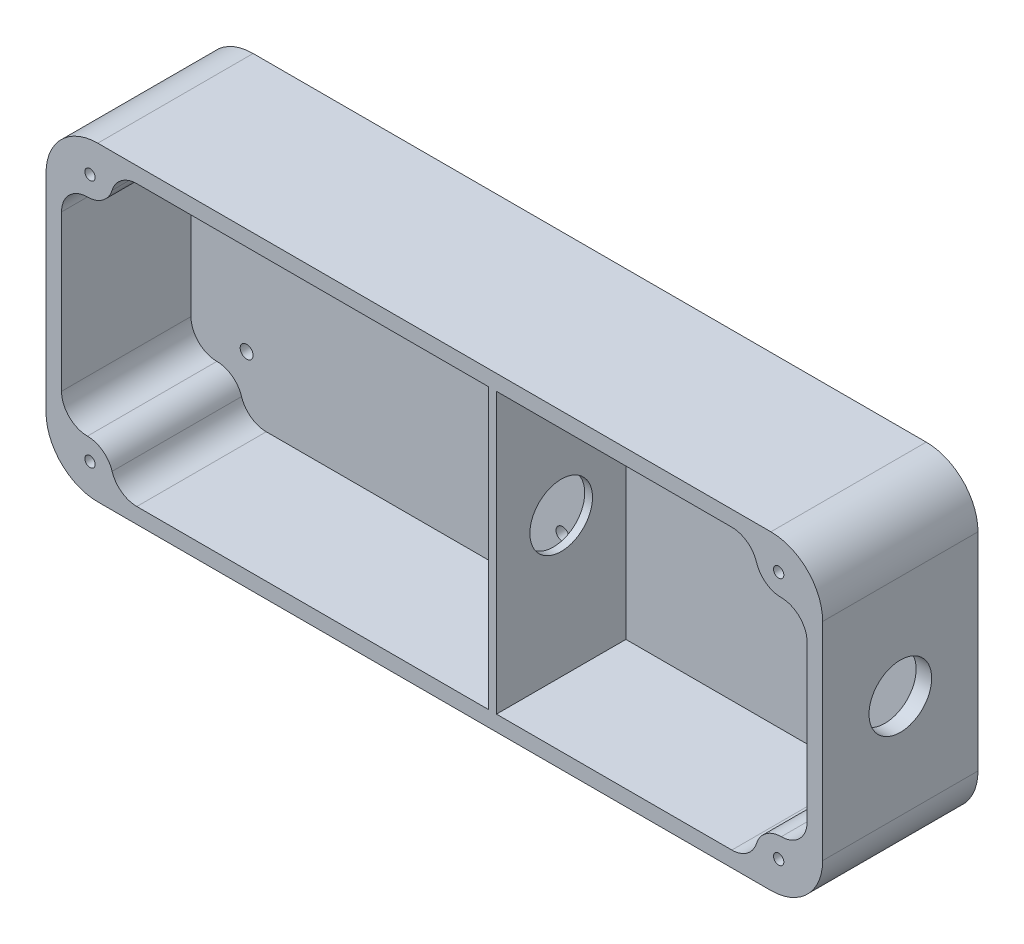
from build123d import *

# Parameters (mm, degrees)
SKETCH_1_W           = 300
SKETCH_1_H           = 120
EXTRUDE_2_DEPTH      = 60
SKETCH_2_W           = 120
SKETCH_2_H           = 80
SKETCH_2_W_2         = 165
CUT_EXTRUDE_1_DEPTH  = 50
FILLET_5_R           = 20
SKETCH_2_5_R         = 2
CUT_EXTRUDE_5_DEPTH  = 40
CUT_EXTRUDE_4_REACH  = 313.769
SKETCH_10_R          = 12.1
SKETCH_13_R          = 5
CUT_EXTRUDE_7_DEPTH  = 20
CUT_EXTRUDE_8_REACH  = 195.587
SKETCH_16_R          = 2.5
CUT_EXTRUDE_9_DEPTH  = 6
SKETCH_2_7_W         = 100
SKETCH_2_7_H         = 14
SKETCH_2_7_W_2       = 145
CUT_EXTRUDE_10_DEPTH = 50
FILLET_6_R           = 10
FILLET_7_R           = 10
FILLET_8_R           = 10
FILLET_9_R           = 10
FILLET_10_R          = 10
FILLET_11_R          = 10
FILLET_12_R          = 10
FILLET_14_R          = 10
FILLET_15_R          = 10
FILLET_16_R          = 10


with BuildPart() as part:
    # Эскиз1 → Бобышка-Вытянуть2 (new body)
    with BuildSketch(Plane.XY):
        Rectangle(SKETCH_1_W, SKETCH_1_H)
    extrude(amount=EXTRUDE_2_DEPTH)

    # Эскиз2 → Вырез-Вытянуть1 (cut)
    with BuildSketch(Plane.XY.offset(60)):
        with Locations((84, 0)):
            Rectangle(SKETCH_2_W, SKETCH_2_H)
        with Locations((-61.5, 0)):
            Rectangle(SKETCH_2_W_2, SKETCH_2_H)
    extrude(amount=-CUT_EXTRUDE_1_DEPTH, mode=Mode.SUBTRACT)

    # Скругление5
    fillet_5_edges = [part.edges().sort_by_distance(p)[0] for p in [
        (150, -60, 30),
        (150, 60, 30),
        (-150, 60, 30),
        (-150, -60, 30),
    ]]
    fillet(fillet_5_edges, radius=FILLET_5_R)

    # Эскиз2<5> → Вырез-Вытянуть5 (cut)
    with BuildSketch(Plane.XY.offset(60)):
        with Locations((133, 48)):
            Circle(SKETCH_2_5_R)
        with Locations((133, -48)):
            Circle(SKETCH_2_5_R)
        with Locations((-133, 48)):
            Circle(SKETCH_2_5_R)
        with Locations((-133, -48)):
            Circle(SKETCH_2_5_R)
    extrude(amount=-CUT_EXTRUDE_5_DEPTH, mode=Mode.SUBTRACT)

    # Эскиз10 → Вырез-Вытянуть4 (cut, up to next)
    with BuildSketch(Plane(origin=(150, 0, 0), x_dir=(0, 0, -1), z_dir=(1, 0, 0)), mode=Mode.PRIVATE) as cut_extrude_4_sk1:
        with Locations(Location((-30, 0, 0), (0, 0, 90))):
            Circle(SKETCH_10_R)
    cut_extrude_4_tool1 = extrude(cut_extrude_4_sk1.sketch, amount=-CUT_EXTRUDE_4_REACH, mode=Mode.PRIVATE) & part.part
    add(cut_extrude_4_tool1.solids().sort_by_distance((150, 0, 30))[0], mode=Mode.SUBTRACT)

    # Эскиз13 → Вырез-Вытянуть7 (cut)
    with BuildSketch(Plane(origin=(0, 0, 0), x_dir=(-1, 0, 0), z_dir=(0, 0, -1))):
        with Locations((-133, 48)):
            Circle(SKETCH_13_R)
        with Locations((-133, -48)):
            Circle(SKETCH_13_R)
        with Locations((133, -48)):
            Circle(SKETCH_13_R)
        with Locations((133, 48)):
            Circle(SKETCH_13_R)
    extrude(amount=-CUT_EXTRUDE_7_DEPTH, mode=Mode.SUBTRACT)

    # Эскиз14 → Вырез-Вытянуть8 (cut, up to next)
    with BuildSketch(Plane(origin=(24, 0, 0), x_dir=(0, 0, -1), z_dir=(1, 0, 0)), mode=Mode.PRIVATE) as cut_extrude_8_sk1:
        with BuildLine():
            ThreePointArc((-28.587012826, 10.260779478), (-35, 12.1), (-41.412987174, 10.260779478))
            Line((-41.412987174, 10.260779478), (-35, 0))
            Line((-35, 0), (-28.587012826, 10.260779478))
        make_face()
    cut_extrude_8_tool1 = extrude(cut_extrude_8_sk1.sketch, amount=-CUT_EXTRUDE_8_REACH, mode=Mode.PRIVATE) & part.part
    # Эскиз14 → Вырез-Вытянуть8 (cut, up to next)
    with BuildSketch(Plane(origin=(24, 0, 0), x_dir=(0, 0, -1), z_dir=(1, 0, 0)), mode=Mode.PRIVATE) as cut_extrude_8_sk2:
        with BuildLine():
            Line((-35, 0), (-41.412987174, 10.260779478))
            ThreePointArc((-41.412987174, 10.260779478), (-47.1, 0), (-41.412987174, -10.260779478))
            Line((-41.412987174, -10.260779478), (-35, 0))
        make_face()
    cut_extrude_8_tool2 = extrude(cut_extrude_8_sk2.sketch, amount=-CUT_EXTRUDE_8_REACH, mode=Mode.PRIVATE) & part.part
    # Эскиз14 → Вырез-Вытянуть8 (cut, up to next)
    with BuildSketch(Plane(origin=(24, 0, 0), x_dir=(0, 0, -1), z_dir=(1, 0, 0)), mode=Mode.PRIVATE) as cut_extrude_8_sk3:
        with BuildLine():
            Line((-28.587012826, 10.260779478), (-35, 0))
            Line((-35, 0), (-28.587012826, -10.260779478))
            ThreePointArc((-28.587012826, -10.260779478), (-24.416825977, -5.865699242), (-22.9, 0))
            ThreePointArc((-22.9, 0), (-24.416825977, 5.865699242), (-28.587012826, 10.260779478))
        make_face()
    cut_extrude_8_tool3 = extrude(cut_extrude_8_sk3.sketch, amount=-CUT_EXTRUDE_8_REACH, mode=Mode.PRIVATE) & part.part
    # Эскиз14 → Вырез-Вытянуть8 (cut, up to next)
    with BuildSketch(Plane(origin=(24, 0, 0), x_dir=(0, 0, -1), z_dir=(1, 0, 0)), mode=Mode.PRIVATE) as cut_extrude_8_sk4:
        with BuildLine():
            Line((-28.587012826, -10.260779478), (-35, 0))
            Line((-35, 0), (-41.412987174, -10.260779478))
            ThreePointArc((-41.412987174, -10.260779478), (-35, -12.1), (-28.587012826, -10.260779478))
        make_face()
    cut_extrude_8_tool4 = extrude(cut_extrude_8_sk4.sketch, amount=-CUT_EXTRUDE_8_REACH, mode=Mode.PRIVATE) & part.part
    # Эскиз14 → Вырез-Вытянуть8 (cut, up to next)
    with BuildSketch(Plane(origin=(24, 0, 0), x_dir=(0, 0, -1), z_dir=(1, 0, 0)), mode=Mode.PRIVATE) as cut_extrude_8_sk5:
        with BuildLine():
            ThreePointArc((-28.587012826, 10.260779478), (-35, 12.1), (-41.412987174, 10.260779478))
            Line((-41.412987174, 10.260779478), (-35, 0))
            Line((-35, 0), (-28.587012826, 10.260779478))
        make_face()
    cut_extrude_8_tool5 = extrude(cut_extrude_8_sk5.sketch, amount=-CUT_EXTRUDE_8_REACH, mode=Mode.PRIVATE) & part.part
    # Эскиз14 → Вырез-Вытянуть8 (cut, up to next)
    with BuildSketch(Plane(origin=(24, 0, 0), x_dir=(0, 0, -1), z_dir=(1, 0, 0)), mode=Mode.PRIVATE) as cut_extrude_8_sk6:
        with BuildLine():
            Line((-35, 0), (-41.412987174, 10.260779478))
            ThreePointArc((-41.412987174, 10.260779478), (-47.1, 0), (-41.412987174, -10.260779478))
            Line((-41.412987174, -10.260779478), (-35, 0))
        make_face()
    cut_extrude_8_tool6 = extrude(cut_extrude_8_sk6.sketch, amount=-CUT_EXTRUDE_8_REACH, mode=Mode.PRIVATE) & part.part
    # Эскиз14 → Вырез-Вытянуть8 (cut, up to next)
    with BuildSketch(Plane(origin=(24, 0, 0), x_dir=(0, 0, -1), z_dir=(1, 0, 0)), mode=Mode.PRIVATE) as cut_extrude_8_sk7:
        with BuildLine():
            Line((-28.587012826, 10.260779478), (-35, 0))
            Line((-35, 0), (-28.587012826, -10.260779478))
            ThreePointArc((-28.587012826, -10.260779478), (-24.416825977, -5.865699242), (-22.9, 0))
            ThreePointArc((-22.9, 0), (-24.416825977, 5.865699242), (-28.587012826, 10.260779478))
        make_face()
    cut_extrude_8_tool7 = extrude(cut_extrude_8_sk7.sketch, amount=-CUT_EXTRUDE_8_REACH, mode=Mode.PRIVATE) & part.part
    # Эскиз14 → Вырез-Вытянуть8 (cut, up to next)
    with BuildSketch(Plane(origin=(24, 0, 0), x_dir=(0, 0, -1), z_dir=(1, 0, 0)), mode=Mode.PRIVATE) as cut_extrude_8_sk8:
        with BuildLine():
            Line((-28.587012826, -10.260779478), (-35, 0))
            Line((-35, 0), (-41.412987174, -10.260779478))
            ThreePointArc((-41.412987174, -10.260779478), (-35, -12.1), (-28.587012826, -10.260779478))
        make_face()
    cut_extrude_8_tool8 = extrude(cut_extrude_8_sk8.sketch, amount=-CUT_EXTRUDE_8_REACH, mode=Mode.PRIVATE) & part.part
    # Эскиз14 → Вырез-Вытянуть8 (cut, up to next)
    with BuildSketch(Plane(origin=(24, 0, 0), x_dir=(0, 0, -1), z_dir=(1, 0, 0)), mode=Mode.PRIVATE) as cut_extrude_8_sk9:
        with BuildLine():
            ThreePointArc((-28.587012826, 10.260779478), (-35, 12.1), (-41.412987174, 10.260779478))
            Line((-41.412987174, 10.260779478), (-35, 0))
            Line((-35, 0), (-28.587012826, 10.260779478))
        make_face()
    cut_extrude_8_tool9 = extrude(cut_extrude_8_sk9.sketch, amount=-CUT_EXTRUDE_8_REACH, mode=Mode.PRIVATE) & part.part
    # Эскиз14 → Вырез-Вытянуть8 (cut, up to next)
    with BuildSketch(Plane(origin=(24, 0, 0), x_dir=(0, 0, -1), z_dir=(1, 0, 0)), mode=Mode.PRIVATE) as cut_extrude_8_sk10:
        with BuildLine():
            Line((-35, 0), (-41.412987174, 10.260779478))
            ThreePointArc((-41.412987174, 10.260779478), (-47.1, 0), (-41.412987174, -10.260779478))
            Line((-41.412987174, -10.260779478), (-35, 0))
        make_face()
    cut_extrude_8_tool10 = extrude(cut_extrude_8_sk10.sketch, amount=-CUT_EXTRUDE_8_REACH, mode=Mode.PRIVATE) & part.part
    # Эскиз14 → Вырез-Вытянуть8 (cut, up to next)
    with BuildSketch(Plane(origin=(24, 0, 0), x_dir=(0, 0, -1), z_dir=(1, 0, 0)), mode=Mode.PRIVATE) as cut_extrude_8_sk11:
        with BuildLine():
            Line((-28.587012826, 10.260779478), (-35, 0))
            Line((-35, 0), (-28.587012826, -10.260779478))
            ThreePointArc((-28.587012826, -10.260779478), (-24.416825977, -5.865699242), (-22.9, 0))
            ThreePointArc((-22.9, 0), (-24.416825977, 5.865699242), (-28.587012826, 10.260779478))
        make_face()
    cut_extrude_8_tool11 = extrude(cut_extrude_8_sk11.sketch, amount=-CUT_EXTRUDE_8_REACH, mode=Mode.PRIVATE) & part.part
    # Эскиз14 → Вырез-Вытянуть8 (cut, up to next)
    with BuildSketch(Plane(origin=(24, 0, 0), x_dir=(0, 0, -1), z_dir=(1, 0, 0)), mode=Mode.PRIVATE) as cut_extrude_8_sk12:
        with BuildLine():
            Line((-28.587012826, -10.260779478), (-35, 0))
            Line((-35, 0), (-41.412987174, -10.260779478))
            ThreePointArc((-41.412987174, -10.260779478), (-35, -12.1), (-28.587012826, -10.260779478))
        make_face()
    cut_extrude_8_tool12 = extrude(cut_extrude_8_sk12.sketch, amount=-CUT_EXTRUDE_8_REACH, mode=Mode.PRIVATE) & part.part
    # Эскиз14 → Вырез-Вытянуть8 (cut, up to next)
    with BuildSketch(Plane(origin=(24, 0, 0), x_dir=(0, 0, -1), z_dir=(1, 0, 0)), mode=Mode.PRIVATE) as cut_extrude_8_sk13:
        with BuildLine():
            ThreePointArc((-28.587012826, 10.260779478), (-35, 12.1), (-41.412987174, 10.260779478))
            Line((-41.412987174, 10.260779478), (-35, 0))
            Line((-35, 0), (-28.587012826, 10.260779478))
        make_face()
    cut_extrude_8_tool13 = extrude(cut_extrude_8_sk13.sketch, amount=-CUT_EXTRUDE_8_REACH, mode=Mode.PRIVATE) & part.part
    # Эскиз14 → Вырез-Вытянуть8 (cut, up to next)
    with BuildSketch(Plane(origin=(24, 0, 0), x_dir=(0, 0, -1), z_dir=(1, 0, 0)), mode=Mode.PRIVATE) as cut_extrude_8_sk14:
        with BuildLine():
            Line((-35, 0), (-41.412987174, 10.260779478))
            ThreePointArc((-41.412987174, 10.260779478), (-47.1, 0), (-41.412987174, -10.260779478))
            Line((-41.412987174, -10.260779478), (-35, 0))
        make_face()
    cut_extrude_8_tool14 = extrude(cut_extrude_8_sk14.sketch, amount=-CUT_EXTRUDE_8_REACH, mode=Mode.PRIVATE) & part.part
    # Эскиз14 → Вырез-Вытянуть8 (cut, up to next)
    with BuildSketch(Plane(origin=(24, 0, 0), x_dir=(0, 0, -1), z_dir=(1, 0, 0)), mode=Mode.PRIVATE) as cut_extrude_8_sk15:
        with BuildLine():
            Line((-28.587012826, 10.260779478), (-35, 0))
            Line((-35, 0), (-28.587012826, -10.260779478))
            ThreePointArc((-28.587012826, -10.260779478), (-24.416825977, -5.865699242), (-22.9, 0))
            ThreePointArc((-22.9, 0), (-24.416825977, 5.865699242), (-28.587012826, 10.260779478))
        make_face()
    cut_extrude_8_tool15 = extrude(cut_extrude_8_sk15.sketch, amount=-CUT_EXTRUDE_8_REACH, mode=Mode.PRIVATE) & part.part
    # Эскиз14 → Вырез-Вытянуть8 (cut, up to next)
    with BuildSketch(Plane(origin=(24, 0, 0), x_dir=(0, 0, -1), z_dir=(1, 0, 0)), mode=Mode.PRIVATE) as cut_extrude_8_sk16:
        with BuildLine():
            Line((-28.587012826, -10.260779478), (-35, 0))
            Line((-35, 0), (-41.412987174, -10.260779478))
            ThreePointArc((-41.412987174, -10.260779478), (-35, -12.1), (-28.587012826, -10.260779478))
        make_face()
    cut_extrude_8_tool16 = extrude(cut_extrude_8_sk16.sketch, amount=-CUT_EXTRUDE_8_REACH, mode=Mode.PRIVATE) & part.part
    add(cut_extrude_8_tool1.solids().sort_by_distance((24, 7.653652, 35))[0], mode=Mode.SUBTRACT)
    add(cut_extrude_8_tool2.solids().sort_by_distance((24, 0, 41.758091))[0], mode=Mode.SUBTRACT)
    add(cut_extrude_8_tool3.solids().sort_by_distance((24, 0, 28.241909))[0], mode=Mode.SUBTRACT)
    add(cut_extrude_8_tool4.solids().sort_by_distance((24, -7.653652, 35))[0], mode=Mode.SUBTRACT)
    add(cut_extrude_8_tool5.solids().sort_by_distance((24, 7.653652, 35))[0], mode=Mode.SUBTRACT)
    add(cut_extrude_8_tool6.solids().sort_by_distance((24, 0, 41.758091))[0], mode=Mode.SUBTRACT)
    add(cut_extrude_8_tool7.solids().sort_by_distance((24, 0, 28.241909))[0], mode=Mode.SUBTRACT)
    add(cut_extrude_8_tool8.solids().sort_by_distance((24, -7.653652, 35))[0], mode=Mode.SUBTRACT)
    add(cut_extrude_8_tool9.solids().sort_by_distance((24, 7.653652, 35))[0], mode=Mode.SUBTRACT)
    add(cut_extrude_8_tool10.solids().sort_by_distance((24, 0, 41.758091))[0], mode=Mode.SUBTRACT)
    add(cut_extrude_8_tool11.solids().sort_by_distance((24, 0, 28.241909))[0], mode=Mode.SUBTRACT)
    add(cut_extrude_8_tool12.solids().sort_by_distance((24, -7.653652, 35))[0], mode=Mode.SUBTRACT)
    add(cut_extrude_8_tool13.solids().sort_by_distance((24, 7.653652, 35))[0], mode=Mode.SUBTRACT)
    add(cut_extrude_8_tool14.solids().sort_by_distance((24, 0, 41.758091))[0], mode=Mode.SUBTRACT)
    add(cut_extrude_8_tool15.solids().sort_by_distance((24, 0, 28.241909))[0], mode=Mode.SUBTRACT)
    add(cut_extrude_8_tool16.solids().sort_by_distance((24, -7.653652, 35))[0], mode=Mode.SUBTRACT)

    # Эскиз16 → Вырез-Вытянуть9 (cut)
    with BuildSketch(Plane.XY.offset(10)):
        with Locations((-0.5, -31)):
            Circle(SKETCH_16_R)
        with Locations((-122.5, -31)):
            Circle(SKETCH_16_R)
        with Locations((-0.5, 31)):
            Circle(SKETCH_16_R)
        with Locations((-122.5, 31)):
            Circle(SKETCH_16_R)
    extrude(amount=-CUT_EXTRUDE_9_DEPTH, mode=Mode.SUBTRACT)

    # Эскиз2<7> → Вырез-Вытянуть10 (cut)
    with BuildSketch(Plane.XY.offset(60)):
        with Locations((74, -47)):
            Rectangle(SKETCH_2_7_W, SKETCH_2_7_H)
        with Locations((-51.5, -47)):
            Rectangle(SKETCH_2_7_W_2, SKETCH_2_7_H)
        with Locations((-51.5, 47)):
            Rectangle(SKETCH_2_7_W_2, SKETCH_2_7_H)
        with Locations((74, 47)):
            Rectangle(SKETCH_2_7_W, SKETCH_2_7_H)
    extrude(amount=-CUT_EXTRUDE_10_DEPTH, mode=Mode.SUBTRACT)

    # Скругление6
    fillet_6_edges = [part.edges().sort_by_distance(p)[0] for p in [
        (-124, -40, 35),
    ]]
    fillet(fillet_6_edges, radius=FILLET_6_R)

    # Скругление7
    fillet_7_edges = [part.edges().sort_by_distance(p)[0] for p in [
        (-144, -40, 35),
    ]]
    fillet(fillet_7_edges, radius=FILLET_7_R - 0.0001)  # a hair under: the kernel refuses the full size

    # Скругление8
    fillet_8_edges = [part.edges().sort_by_distance(p)[0] for p in [
        (124, -40, 35),
    ]]
    fillet(fillet_8_edges, radius=FILLET_8_R)

    # Скругление9
    fillet_9_edges = [part.edges().sort_by_distance(p)[0] for p in [
        (144, -40, 35),
    ]]
    fillet(fillet_9_edges, radius=FILLET_9_R - 0.0001)  # a hair under: the kernel refuses the full size

    # Скругление10
    fillet_10_edges = [part.edges().sort_by_distance(p)[0] for p in [
        (124, 40, 35),
    ]]
    fillet(fillet_10_edges, radius=FILLET_10_R)

    # Скругление11
    fillet_11_edges = [part.edges().sort_by_distance(p)[0] for p in [
        (124, -54, 35),
    ]]
    fillet(fillet_11_edges, radius=FILLET_11_R)

    # Скругление12
    fillet_12_edges = [part.edges().sort_by_distance(p)[0] for p in [
        (-124, -54, 35),
    ]]
    fillet(fillet_12_edges, radius=FILLET_12_R)

    # Скругление14
    fillet_14_edges = [part.edges().sort_by_distance(p)[0] for p in [
        (-144, 40, 35),
    ]]
    fillet(fillet_14_edges, radius=FILLET_14_R)
    fillet_14_2_edges = [part.edges().sort_by_distance(p)[0] for p in [
        (-124, 40, 35),
    ]]
    fillet(fillet_14_2_edges, radius=FILLET_14_R - 0.0001)  # a hair under: the kernel refuses the full size

    # Скругление15
    fillet_15_edges = [part.edges().sort_by_distance(p)[0] for p in [
        (-124, 54, 35),
    ]]
    fillet(fillet_15_edges, radius=FILLET_15_R)

    # Скругление16
    fillet_16_edges = [part.edges().sort_by_distance(p)[0] for p in [
        (124, 54, 35),
        (144, 40, 35),
    ]]
    fillet(fillet_16_edges, radius=FILLET_16_R - 0.0001)  # a hair under: the kernel refuses the full size


solid = part.part
